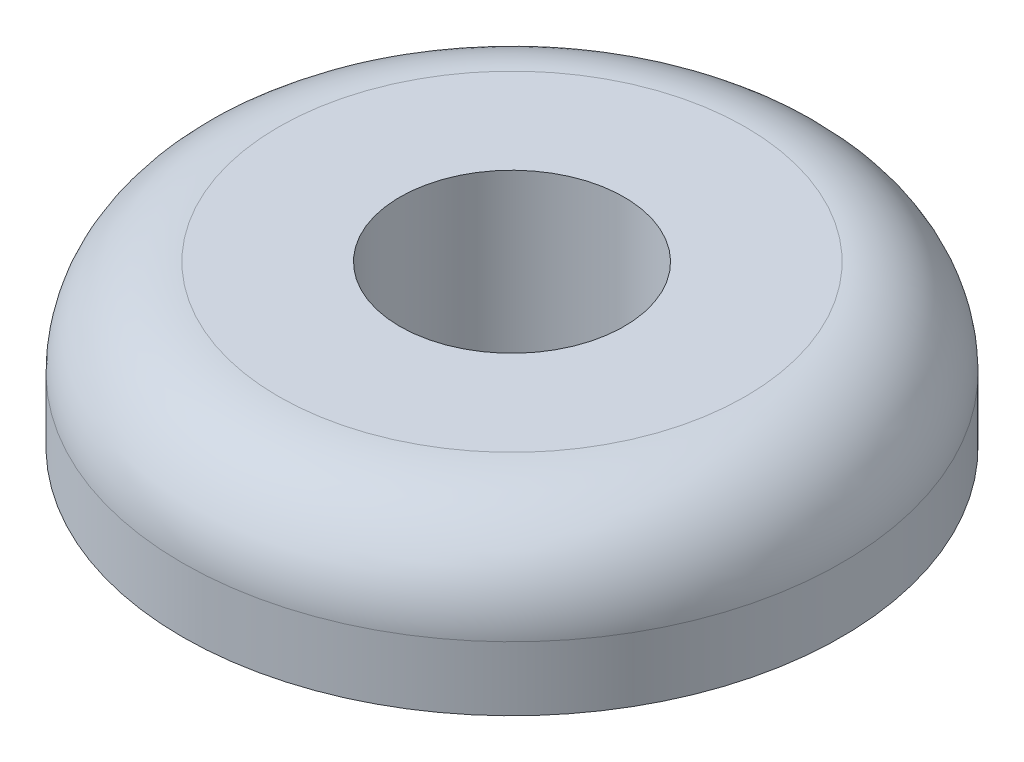
from build123d import *

# Parameters (mm, degrees)
SKETCH1_R           = 10.287
SKETCH1_R_2         = 3.5
BOSS_EXTRUDE1_DEPTH = 5
FILLET1_R           = 3


with BuildPart() as part:
    # Sketch1 → Boss-Extrude1 (new body)
    with BuildSketch(Plane(origin=(0, 0, 0), x_dir=(1, 0, 0), z_dir=(0, 1, 0))):
        Circle(SKETCH1_R)
        Circle(SKETCH1_R_2, mode=Mode.SUBTRACT)
    extrude(amount=BOSS_EXTRUDE1_DEPTH)

    # Fillet1
    fillet1_edges = [part.edges().sort_by_distance(p)[0] for p in [
        (-10.287, 5, 0),
    ]]
    fillet(fillet1_edges, radius=FILLET1_R)


solid = part.part
